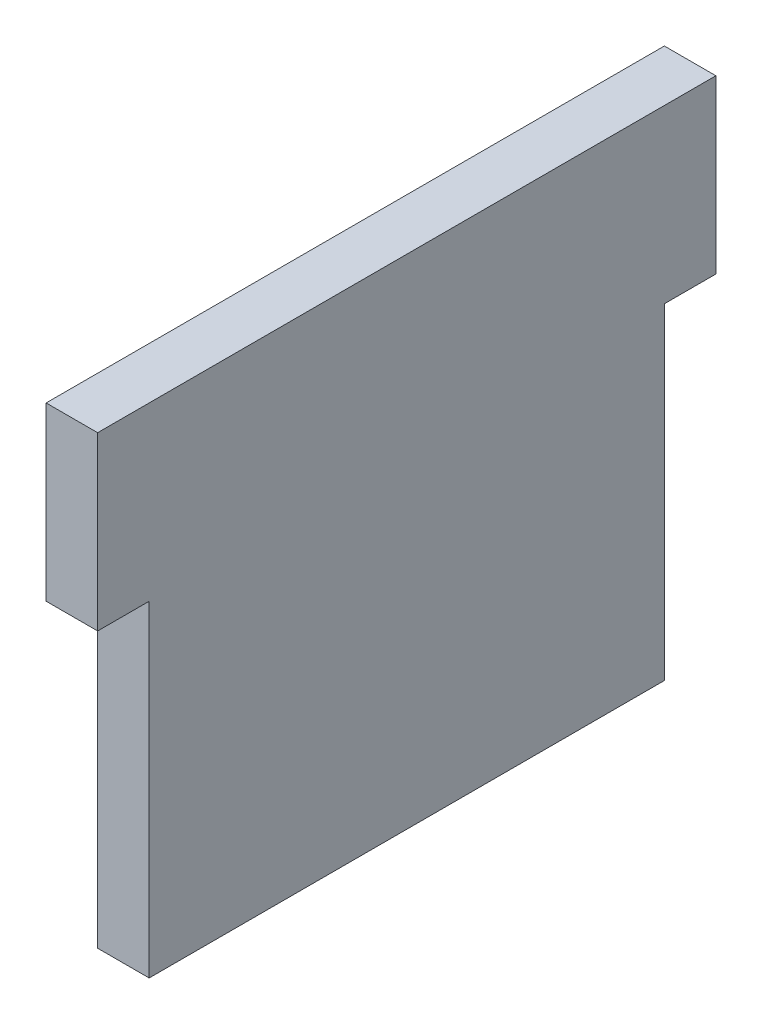
from build123d import *

# Parameters (mm, degrees)
BOSS_EXTRUDE1_DEPTH = 3


with BuildPart() as part:
    # Sketch1 → Boss-Extrude1 (new body)
    with BuildSketch(Plane(origin=(0, 0, 0), x_dir=(0, 0, -1), z_dir=(1, 0, 0))):
        Polygon((15, 6.47), (-15, 6.47), (-15, 25.47), (-18, 25.47), (-18, 35.47), (-15, 35.47), (15, 35.47), (18, 35.47), (18, 25.47), (15, 25.47), align=None)
    extrude(amount=BOSS_EXTRUDE1_DEPTH)


solid = part.part
